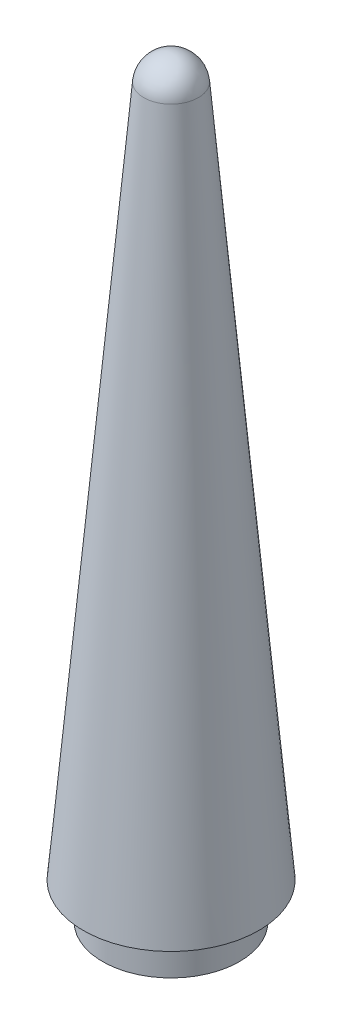
from build123d import *

# Parameters (mm, degrees)
F_1_4_20_TAPPED_HOLE1_D           = 5.1054
F_1_4_20_TAPPED_HOLE1_DEPTH       = 63.5
F_1_4_20_TAPPED_HOLE1_CSINK_D     = 7.62
F_1_4_20_TAPPED_HOLE1_CSINK_ANGLE = 90
F_1_4_20_TAPPED_HOLE1_TIP         = 1.533816902


with BuildPart() as part:
    # Sketch2 → Revolve1 (revolve)
    with BuildSketch(Plane.XY):
        with BuildLine():
            Line((0, 101.668343504), (0, 2.10154956))
            Line((0, 2.10154956), (0, -2.97845044))
            Line((0, -2.97845044), (9.525, -2.97845044))
            Line((9.525, -2.97845044), (9.525, 2.10154956))
            Line((9.525, 2.10154956), (12.202187507, 2.10154956))
            Line((12.202187507, 2.10154956), (3.7955018, 98.190406884))
            ThreePointArc((3.7955018, 98.190406884), (2.573998691, 100.667370157), (0, 101.668343504))
        make_face()
    revolve(axis=Axis((0, 2.10154956, 0), (0, 1, 0)))

    # 1/4-20 Tapped Hole1
    with Locations(Plane.XZ.offset(2.97845044)):
        with Locations((0, 0)):
            CounterSinkHole(F_1_4_20_TAPPED_HOLE1_D / 2, F_1_4_20_TAPPED_HOLE1_CSINK_D / 2, depth=F_1_4_20_TAPPED_HOLE1_DEPTH, counter_sink_angle=F_1_4_20_TAPPED_HOLE1_CSINK_ANGLE)
            with Locations((0, 0, -(F_1_4_20_TAPPED_HOLE1_DEPTH + F_1_4_20_TAPPED_HOLE1_TIP / 2))):  # 118° drill point
                Cone(0, F_1_4_20_TAPPED_HOLE1_D / 2, F_1_4_20_TAPPED_HOLE1_TIP, mode=Mode.SUBTRACT)


solid = part.part
